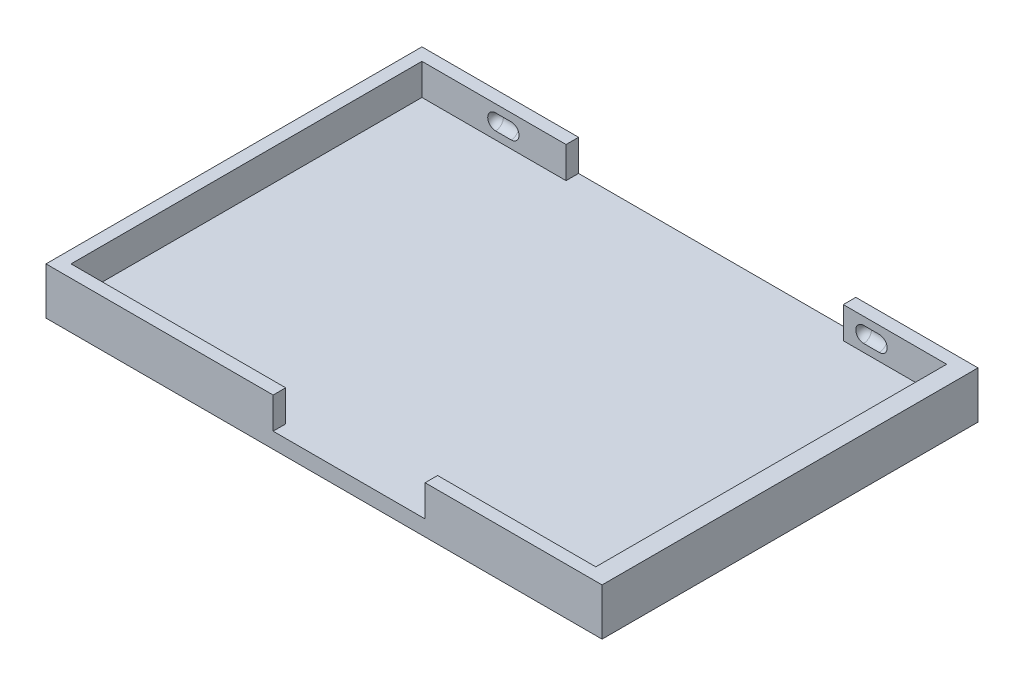
from build123d import *

# Parameters (mm, degrees)
SKETCH_1_W          = 35.5
SKETCH_1_H          = 24
EXTRUDE_1_DEPTH     = 3
SKETCH_2_W          = 33.5
SKETCH_2_H          = 22.4
CUT_EXTRUDE_1_DEPTH = 2
SKETCH_4_W          = 9.7
SKETCH_4_H          = 0.8
CUT_EXTRUDE_2_DEPTH = 2
SKETCH_5_W          = 17.7
SKETCH_5_H          = 0.8
CUT_EXTRUDE_3_DEPTH = 2


with BuildPart() as part:
    # 草图1 → 凸台-拉伸1 (new body)
    with BuildSketch(Plane(origin=(0, 0, 0), x_dir=(1, 0, 0), z_dir=(0, 1, 0))):
        Rectangle(SKETCH_1_W, SKETCH_1_H)
    extrude(amount=EXTRUDE_1_DEPTH)

    # 草图2 → 切除-拉伸1 (cut)
    with BuildSketch(Plane(origin=(0, 3, 0), x_dir=(1, 0, 0), z_dir=(0, 1, 0))):
        with Locations((-0.2, 0)):
            Rectangle(SKETCH_2_W, SKETCH_2_H)
    extrude(amount=-CUT_EXTRUDE_1_DEPTH, mode=Mode.SUBTRACT)

    # 草图4 → 切除-拉伸2 (cut)
    with BuildSketch(Plane(origin=(0, 3, 0), x_dir=(1, 0, 0), z_dir=(0, 1, 0))):
        with Locations((1.6, -11.6)):
            Rectangle(SKETCH_4_W, SKETCH_4_H)
    extrude(amount=-CUT_EXTRUDE_2_DEPTH, mode=Mode.SUBTRACT)

    # 草图5 → 切除-拉伸3 (cut)
    with BuildSketch(Plane(origin=(0, 3, 0), x_dir=(1, 0, 0), z_dir=(0, 1, 0))):
        with Locations((1.1, 11.6)):
            Rectangle(SKETCH_5_W, SKETCH_5_H)
    extrude(amount=-CUT_EXTRUDE_3_DEPTH, mode=Mode.SUBTRACT)

    # 草图6 → 切除-旋转1 (revolve, cut)
    with BuildSketch(Plane(origin=(0, 0, 11.2), x_dir=(-1, 0, 0), z_dir=(0, 0, -1))):
        with BuildLine():
            Line((-9.385997147, 2), (-11.385997147, 2))
            ThreePointArc((-11.385997147, 2), (-11.239550537, 2.353553391), (-10.885997147, 2.5))
            Line((-10.885997147, 2.5), (-9.885997147, 2.5))
            ThreePointArc((-9.885997147, 2.5), (-9.532443756, 2.353553391), (-9.385997147, 2))
        make_face()
        with BuildLine():
            Line((9.75, 2), (11.75, 2))
            ThreePointArc((11.75, 2), (11.603553391, 2.353553391), (11.25, 2.5))
            Line((11.25, 2.5), (10.25, 2.5))
            ThreePointArc((10.25, 2.5), (9.896446609, 2.353553391), (9.75, 2))
        make_face()
    revolve(axis=Axis((9.385997147, 2, 11.2), (1, 0, 0)), mode=Mode.SUBTRACT)

    # 草图7 → 切除-旋转2 (revolve, cut)
    with BuildSketch(Plane.XY.offset(-11.2)):
        with BuildLine():
            Line((-10.75, 2), (-12.75, 2))
            ThreePointArc((-12.75, 2), (-12.603553391, 2.353553391), (-12.25, 2.5))
            Line((-12.25, 2.5), (-11.25, 2.5))
            ThreePointArc((-11.25, 2.5), (-10.896446609, 2.353553391), (-10.75, 2))
        make_face()
        with BuildLine():
            Line((10.75, 2), (12.75, 2))
            ThreePointArc((12.75, 2), (12.603553391, 2.353553391), (12.25, 2.5))
            Line((12.25, 2.5), (11.25, 2.5))
            ThreePointArc((11.25, 2.5), (10.896446609, 2.353553391), (10.75, 2))
        make_face()
    revolve(axis=Axis((-10.75, 2, -11.2), (-1, 0, 0)), mode=Mode.SUBTRACT)


solid = part.part
